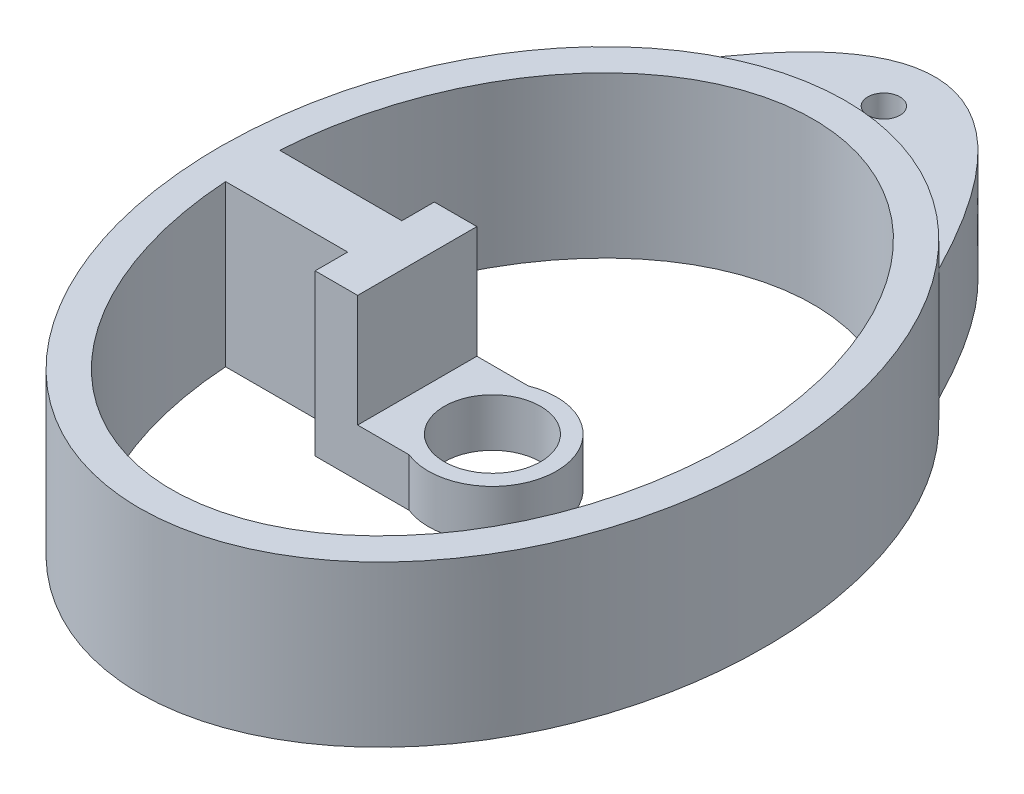
from build123d import *

# Parameters (mm, degrees)
EXTRUDE_THIN1_DEPTH = 20
BOSS_EXTRUDE1_DEPTH = 14
SKETCH4_R           = 2
CUT_EXTRUDE1_DEPTH  = 89.888694158
SKETCH5_W           = 5.302479054
SKETCH5_H           = 6.748448619
SKETCH5_H_2         = 4.056581205
BOSS_EXTRUDE2_DEPTH = 20
BOSS_EXTRUDE3_DEPTH = 6


# Read off the part's stored shape, not the designer's step: Extrude-Thin1
with BuildPart() as part:
    # Extrude-Thin1 outline → Extrude-Thin1 (new body)
    with BuildSketch(Plane(origin=(0, 0, 0), x_dir=(1, 0, 0), z_dir=(0, 1, 0))):
        with BuildLine():
            add(Edge.make_bspline(
                [(-23.58974359, -33.615384615), (-20.995110065, -33.615384615), (-18.467373119, -33.239551934), (-15.385362875, -32.333452971), (-14.771771354, -32.129710999), (-13.557374033, -31.679592149), (-12.960928416, -31.434931656), (-11.202237057, -30.645088381), (-10.070535892, -30.04422775), (-8.429860675, -29.039260046), (-7.892475524, -28.68694183), (-6.836296288, -27.948416881), (-6.316119634, -27.561059371), (-4.796806302, -26.360038808), (-3.836947784, -25.506951411), (-2.013092805, -23.706017552), (-1.149143975, -22.758124005), (0.488933467, -20.773550169), (1.26476629, -19.733415717), (3.424583213, -16.545202648), (4.657855435, -14.313843486), (6.240412844, -10.829789534), (6.722942042, -9.645381234), (7.600873164, -7.231912601), (7.99668984, -6.000154654), (9.040976053, -2.293023476), (9.554183355, 0.210222087), (10.068495848, 4.009527121), (10.197064218, 5.283417999), (10.368461306, 7.846111727), (10.411057223, 9.138074106), (10.408620303, 12.986609525), (10.236110759, 15.529888842), (9.551294496, 20.571884263), (9.039209831, 23.070629487), (8.167175065, 26.163644348), (7.980658673, 26.781959503), (7.585733722, 28.008096702), (7.377416855, 28.615835855), (6.719621283, 30.422926617), (6.237373682, 31.606188878), (4.654635734, 35.089202799), (3.419960778, 37.32307056), (1.614103027, 39.986512313), (1.238636994, 40.514008012), (0.465783886, 41.547003153), (0.068421669, 42.052639392), (-1.157170828, 43.536270001), (-2.018801105, 44.481091396), (-3.837209328, 46.276233245), (-4.793941015, 47.12659964), (-6.307805138, 48.323918024), (-6.826859108, 48.710828555), (-7.887205655, 49.452704873), (-8.426046834, 49.806067626), (-11.164223134, 51.483725167), (-13.49430742, 52.544897944), (-18.473500398, 54.012393955), (-21.00077816, 54.382319174), (-24.207471083, 54.385176289), (-24.851218501, 54.36248978), (-26.143666115, 54.269296365), (-26.788691287, 54.198888333), (-28.700223253, 53.920336663), (-29.951541044, 53.644556051), (-31.795600115, 53.102169528), (-32.404785107, 52.899862394), (-33.6122584, 52.452639505), (-34.211991674, 52.207063138), (-35.984916212, 51.410973267), (-37.120612358, 50.806965452), (-39.307979019, 49.46582485), (-40.359606319, 48.728623597), (-41.877534849, 47.528533948), (-42.374962551, 47.111458409), (-43.341393335, 46.254390014), (-43.810718016, 45.814316119), (-46.091926305, 43.559603089), (-47.709937149, 41.583904304), (-49.510270677, 38.929704935), (-49.859091984, 38.389522956), (-50.534666569, 37.290825998), (-50.861480205, 36.732037149), (-51.800657865, 35.044859018), (-52.375237967, 33.900436519), (-53.957133229, 30.413123384), (-54.82374183, 28.016620896), (-55.865692145, 24.323578553), (-56.169770179, 23.075721279), (-56.691637408, 20.548616754), (-56.906751871, 19.282506238), (-57.421075763, 15.476859384), (-57.590225138, 12.930061308), (-57.589501283, 9.095657421), (-57.546605258, 7.815141219), (-57.416790051, 5.890711417), (-57.362460542, 5.247452456), (-57.232202676, 3.966250524), (-57.156353115, 3.328584645), (-56.723863956, 0.154831636), (-56.208773022, -2.337874785), (-54.829431737, -7.227694975), (-53.96566359, -9.624940761), (-52.637340604, -12.553432932), (-52.358430966, -13.137037509), (-51.778007873, -14.289548785), (-51.476753335, -14.858107225), (-50.539319044, -16.540313373), (-49.869560167, -17.630555723), (-48.4355325, -19.745165019), (-47.671296508, -20.769554826), (-46.447929511, -22.252459843), (-46.027276308, -22.737794894), (-45.158795935, -23.689524168), (-44.709628385, -24.157209722), (-42.409941418, -26.427158536), (-40.40714329, -28.022244093), (-37.670711233, -29.700556785), (-37.111639724, -30.020254657), (-35.968545846, -30.625850755), (-35.38443134, -30.911539439), (-33.621428961, -31.702681203), (-32.422934569, -32.147420619), (-29.978728458, -32.868315032), (-28.733029546, -33.144515753), (-26.826985805, -33.424943605), (-26.185372824, -33.496050802), (-24.88904297, -33.59147915), (-24.238401971, -33.615384615), (-23.58974359, -33.615384615)],
                knots=[0, 0, 0, 0, 0.03125, 0.03125, 0.0390625, 0.0390625, 0.046875, 0.046875, 0.0625, 0.0625, 0.0703125, 0.0703125, 0.078125, 0.078125, 0.09375, 0.09375, 0.109375, 0.109375, 0.125, 0.125, 0.15625, 0.15625, 0.171875, 0.171875, 0.1875, 0.1875, 0.21875, 0.21875, 0.234375, 0.234375, 0.25, 0.25, 0.28125, 0.28125, 0.3125, 0.3125, 0.3203125, 0.3203125, 0.328125, 0.328125, 0.34375, 0.34375, 0.375, 0.375, 0.3828125, 0.3828125, 0.390625, 0.390625, 0.40625, 0.40625, 0.421875, 0.421875, 0.4296875, 0.4296875, 0.4375, 0.4375, 0.46875, 0.46875, 0.5, 0.5, 0.5078125, 0.5078125, 0.515625, 0.515625, 0.53125, 0.53125, 0.5390625, 0.5390625, 0.546875, 0.546875, 0.5625, 0.5625, 0.578125, 0.578125, 0.5859375, 0.5859375, 0.59375, 0.59375, 0.625, 0.625, 0.6328125, 0.6328125, 0.640625, 0.640625, 0.65625, 0.65625, 0.6875, 0.6875, 0.703125, 0.703125, 0.71875, 0.71875, 0.75, 0.75, 0.765625, 0.765625, 0.7734375, 0.7734375, 0.78125, 0.78125, 0.8125, 0.8125, 0.84375, 0.84375, 0.8515625, 0.8515625, 0.859375, 0.859375, 0.875, 0.875, 0.890625, 0.890625, 0.8984375, 0.8984375, 0.90625, 0.90625, 0.9375, 0.9375, 0.9453125, 0.9453125, 0.953125, 0.953125, 0.96875, 0.96875, 0.984375, 0.984375, 0.9921875, 0.9921875, 1, 1, 1, 1], degree=3))
        make_face()
        with BuildLine():
            add(Edge.make_bspline(
                [(-23.58974359, 50.384615385), (-75.551267817, 50.384615385), (-49.570505703, -9.615384615), (-23.58974359, -69.615384615), (2.391018524, -9.615384615), (28.371780637, 50.384615385), (-23.58974359, 50.384615385)],
                knots=[0, 0, 0, 2.094395102, 2.094395102, 4.188790205, 4.188790205, 6.283185307, 6.283185307, 6.283185307], degree=2, weights=[1, 0.5, 1, 0.5, 1, 0.5, 1]))
        make_face(mode=Mode.SUBTRACT)
    extrude(amount=EXTRUDE_THIN1_DEPTH)

    # Sketch3 → Boss-Extrude1 (add)
    with BuildSketch(Plane(origin=(0, 17, 0), x_dir=(1, 0, 0), z_dir=(0, 1, 0))):
        with BuildLine():
            Line((-44.598646922, 45.031347523), (-23.569660178, 54.384607775))
            Line((-23.569660178, 54.384607775), (-2.580876092, 45.031347523))
            add(Edge.make_bspline(
                [(-2.580876092, 45.031347523), (-23.570143524, 86.050632221), (-44.598646922, 45.031347523)],
                knots=[0, 0, 0, 1, 1, 1], degree=2))
        make_face()
    extrude(amount=-BOSS_EXTRUDE1_DEPTH)

    # Sketch4 → Cut-Extrude1 (cut, through all)
    with BuildSketch(Plane(origin=(0, 17, 0), x_dir=(1, 0, 0), z_dir=(0, 1, 0))):
        with Locations(Location((-23.596495867, 59.196027787, 0), (0, 0, 270))):
            Circle(SKETCH4_R)
    extrude(amount=-CUT_EXTRUDE1_DEPTH, mode=Mode.SUBTRACT)

    # Sketch5 → Boss-Extrude2 (add, through all)
    with BuildSketch(Plane(origin=(0, 20, 0), x_dir=(1, 0, 0), z_dir=(0, 1, 0))):
        with BuildLine():
            Line((-53.482814999, 7.010391075), (-38.262204741, 7.010391075))
            Line((-38.262204741, 7.010391075), (-38.262204741, 13.758839694))
            Line((-38.262204741, 13.758839694), (-53.482814999, 13.758839694))
            add(Edge.make_bspline(
                [(-53.482814999, 13.758839694), (-53.58974359, 12.074739583), (-53.58974359, 10.384615385)],
                knots=[1.486340353, 1.486340353, 1.486340353, 1.570796327, 1.570796327, 1.570796327], degree=2, weights=[1, 0.999108531, 1]))
            add(Edge.make_bspline(
                [(-53.58974359, 10.384615385), (-53.58974359, 8.694491187), (-53.482814999, 7.010391075)],
                knots=[1.570796327, 1.570796327, 1.570796327, 1.6552523, 1.6552523, 1.6552523], degree=2, weights=[1, 0.999108531, 1]))
        make_face()
        with Locations((-35.610965214, 10.384615384)):
            Rectangle(SKETCH5_W, SKETCH5_H)
        with Locations((-35.610965214, 4.982100472)):
            Rectangle(SKETCH5_W, SKETCH5_H_2)
        with Locations((-35.610965214, 15.787130296)):
            Rectangle(SKETCH5_W, SKETCH5_H_2)
    extrude(amount=-BOSS_EXTRUDE2_DEPTH)

    # Sketch6 → Boss-Extrude3 (add)
    with BuildSketch(Plane.XZ):
        with BuildLine():
            Line((-26.553378082, -2.95380987), (-32.959725687, -2.95380987))
            Line((-32.959725687, -2.95380987), (-32.959725687, -17.815420899))
            Line((-32.959725687, -17.815420899), (-26.553378082, -17.815420899))
            ThreePointArc((-26.553378082, -17.815420899), (-31.58974359, -10.384615385), (-26.553378082, -2.95380987))
        make_face()
        with BuildLine():
            ThreePointArc((-15.58974359, -10.384615385), (-19.101373949, -3.762339494), (-26.553378082, -2.95380987))
            Line((-26.553378082, -2.95380987), (-26.553378082, -5.167636317))
            ThreePointArc((-26.553378082, -5.167636317), (-20.571615607, -5.198971406), (-17.58974359, -10.384615385))
            ThreePointArc((-17.58974359, -10.384615385), (-20.571615607, -15.570259364), (-26.553378082, -15.601594453))
            Line((-26.553378082, -15.601594453), (-26.553378082, -17.815420899))
            ThreePointArc((-26.553378082, -17.815420899), (-19.101373949, -17.006891275), (-15.58974359, -10.384615385))
        make_face()
        with BuildLine():
            Line((-26.553378082, -5.167636317), (-26.553378082, -2.95380987))
            ThreePointArc((-26.553378082, -2.95380987), (-31.58974359, -10.384615385), (-26.553378082, -17.815420899))
            Line((-26.553378082, -17.815420899), (-26.553378082, -15.601594453))
            ThreePointArc((-26.553378082, -15.601594453), (-29.58974359, -10.384615385), (-26.553378082, -5.167636317))
        make_face()
    extrude(amount=-BOSS_EXTRUDE3_DEPTH)


solid = part.part
